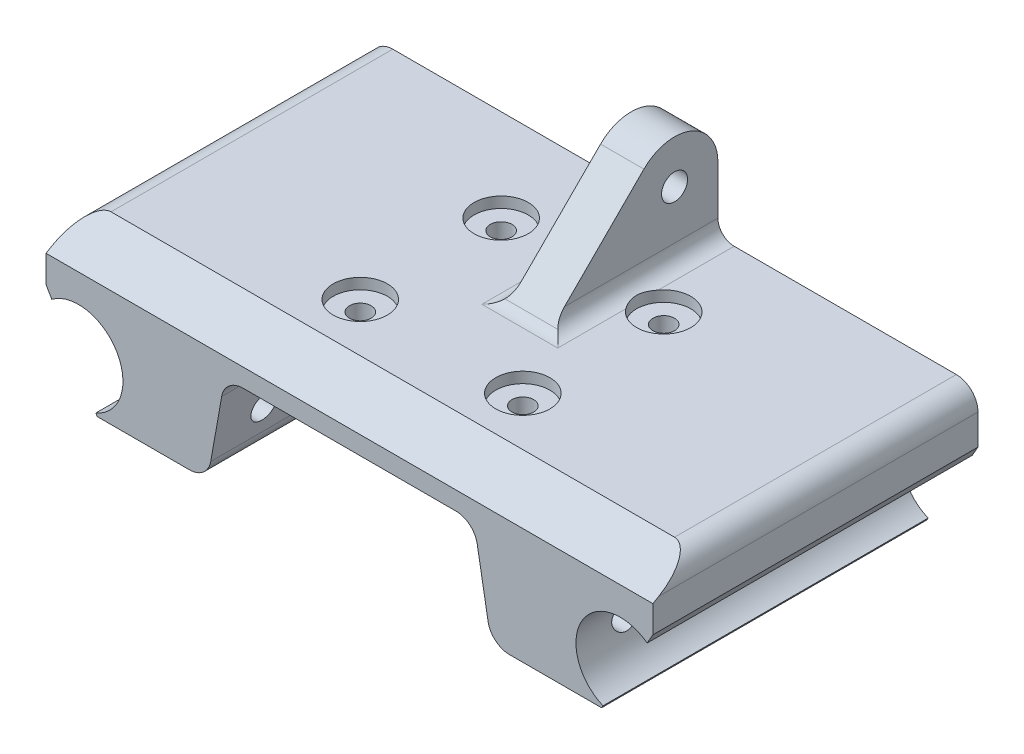
from build123d import *

# Parameters (mm, degrees)
BOSS_EXTRU_1_DEPTH           = 30
ESQUISSE3_R                  = 1
ENL_V_MAT_EXTRU_1_DEPTH      = 44.0464865
ESQUISSE4_R                  = 1.2
ENL_V_MAT_EXTRU_2_DEPTH      = 44.0464865
CONG_1_R                     = 2
ESQUISSE2_R                  = 1.2
BOSS_EXTRU_2_DEPTH           = 4
CONG_2_R                     = 1.5
ENL_V_MAT_EXTRU_3_DEPTH      = 44.04648657
ENL_V_MAT_EXTRU_3_DEPTH_BACK = 1
ESQUISSE5_R                  = 2.5
CHANFREIN1_SIZE              = 4
CHANFREIN1_SIZE_2            = 2.309401077


with BuildPart() as part:
    # Esquisse1 → Boss.-Extru.1 (new body)
    with BuildSketch(Plane.XY):
        with BuildLine():
            Line((0, 0), (-28, 0))
            Line((-28, 0), (-28, -4.803847577))
            Line((-28, -4.803847577), (-27.467711697, -5.725797963))
            ThreePointArc((-27.467711697, -5.725797963), (-21.449295844, -6.95), (-23.398313707, -12.774202037))
            Line((-23.398313707, -12.774202037), (-23.267949192, -13))
            Line((-23.267949192, -13), (-13.086942826, -13))
            Line((-13.086942826, -13), (-11.5, -4))
            Line((-11.5, -4), (0, -4))
            Line((0, -4), (0, 0))
        make_face()
    extrude(amount=BOSS_EXTRU_1_DEPTH)

    # Esquisse3 → Enlèv. mat.-Extru.1 (cut, through all)
    with BuildSketch(Plane(origin=(0, 0, 0), x_dir=(1, 0, 0), z_dir=(0, 1, 0))):
        with Locations(Location((-7.5, -8.5, 0), (0, 0, 180))):
            Circle(ESQUISSE3_R)
        with Locations(Location((-7.5, -21.5, 0), (0, 0, 180))):
            Circle(ESQUISSE3_R)
    extrude(amount=-ENL_V_MAT_EXTRU_1_DEPTH, mode=Mode.SUBTRACT)

    # Esquisse4 → Enlèv. mat.-Extru.2 (cut, through all)
    with BuildSketch(Plane.ZY):
        with Locations(Location((4.5, -9, 0), (0, 0, 180))):
            Circle(ESQUISSE4_R)
        with Locations(Location((25.5, -9, 0), (0, 0, 180))):
            Circle(ESQUISSE4_R)
    extrude(amount=ENL_V_MAT_EXTRU_2_DEPTH, mode=Mode.SUBTRACT)

    # Congé1
    cong_1_edges = [part.edges().sort_by_distance(p)[0] for p in [
        (-11.5, -4, 15),
        (-13.086942826, -13, 15),
        (-28, 0, 15),
    ]]
    fillet(cong_1_edges, radius=CONG_1_R)

    # Symétrie1: part across plane


with BuildPart() as part_1:
    add(part.part)
    add(part.part.mirror(Plane(origin=(0, -4, 30), x_dir=(0, 0, 1), z_dir=(-1, 0, 0))))

    # Esquisse2 → Boss.-Extru.2 (add)
    with BuildSketch(Plane(origin=(0, 0, 0), x_dir=(0, 0, -1), z_dir=(1, 0, 0))):
        with BuildLine():
            Line((0, 0), (-15.656854249, 0))
            Line((-15.656854249, 0), (-6.828427125, 8.828427125))
            ThreePointArc((-6.828427125, 8.828427125), (-2.469266271, 9.69551813), (0, 6))
            Line((0, 6), (0, 0))
        make_face()
        with Locations((-4, 6)):
            Circle(ESQUISSE2_R, mode=Mode.SUBTRACT)
    extrude(amount=BOSS_EXTRU_2_DEPTH)

    # Congé2
    cong_2_edges = [part_1.edges().sort_by_distance(p)[0] for p in [
        (4, 0, 7.828427125),
        (0, 0, 7.828427125),
        (2, 0, 15.656854249),
    ]]
    fillet(cong_2_edges, radius=CONG_2_R)

    # Esquisse5 → Enlèv. mat.-Extru.3 (cut, two sides: drawn at the far end of the back side and taken through both)
    with BuildSketch(Plane(origin=(0, 0, 0), x_dir=(1, 0, 0), z_dir=(0, 1, 0)).offset(-ENL_V_MAT_EXTRU_3_DEPTH_BACK)):
        with Locations((-7.5, -8.5)):
            Circle(ESQUISSE5_R)
        with Locations((-7.5, -21.5)):
            Circle(ESQUISSE5_R)
        with Locations(Location((7.5, -8.5, 0), (0, 0, 216.869897646))):
            Circle(ESQUISSE5_R)
        with Locations((7.5, -21.5)):
            Circle(ESQUISSE5_R)
    extrude(amount=ENL_V_MAT_EXTRU_3_DEPTH + ENL_V_MAT_EXTRU_3_DEPTH_BACK, mode=Mode.SUBTRACT)

    # Chanfrein1
    # the kernel refuses this chamfer: 4, 2.309401077 mm, written as the material it takes off along each edge
    with BuildSketch(Plane(origin=(-36.348343019, 0, 30), x_dir=(0, 0.019326765612700744, -0.9998132206222079), z_dir=(1, 0, 0))) as chanfrein1_piece_1:
        Polygon((CHANFREIN1_SIZE * 0.999813220622, -CHANFREIN1_SIZE * 0.0193267656127), (-CHANFREIN1_SIZE_2 * 0.0193267656107, -CHANFREIN1_SIZE_2 * 0.999813220518), (0, 0), align=None)
    extrude(amount=72.696686037, mode=Mode.SUBTRACT)


solid = part_1.part
